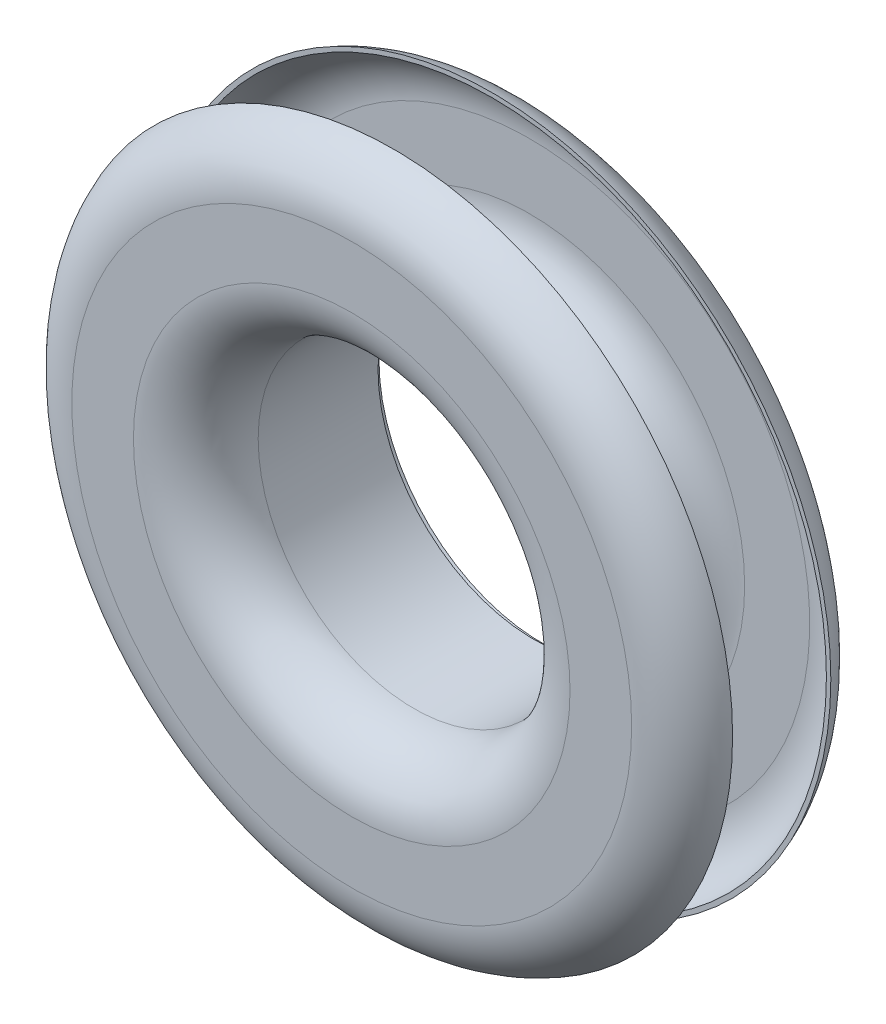
from build123d import *

# Parameters (mm, degrees)
SKETCH3_R           = 10.3505
SKETCH3_R_2         = 4.7625
BOSS_EXTRUDE1_DEPTH = 1.2827
BOSS_EXTRUDE2_START = -5.461
SKETCH4_R           = 5.0165
SKETCH4_R_2         = 4.7625
BOSS_EXTRUDE2_DEPTH = 5.461
FILLET1_R           = 1.905
SKETCH5_R           = 10.3505
SKETCH5_R_2         = 4.7625
BOSS_EXTRUDE3_DEPTH = 1.2827
FILLET2_R           = 1.905
SHELL1_T            = -0.127


# Read off the part's stored shape, not the designer's step: Shell2
with BuildPart() as part:
    # Sketch3 → Boss-Extrude1 (new body)
    with BuildSketch(Plane.XY.offset(5.461)):
        Circle(SKETCH3_R)
        Circle(SKETCH3_R_2, mode=Mode.SUBTRACT)
    extrude(amount=BOSS_EXTRUDE1_DEPTH)

    # Sketch4 → Boss-Extrude2 (add)
    with BuildSketch(Plane.XY.offset(5.461).offset(BOSS_EXTRUDE2_START)):
        Circle(SKETCH4_R)
        Circle(SKETCH4_R_2, mode=Mode.SUBTRACT)
    extrude(amount=BOSS_EXTRUDE2_DEPTH)

    # Fillet1
    # the kernel refuses this fillet: 1.905 mm, written as the material it takes off along each edge
    with BuildSketch(Plane(origin=(0, 0, 6.7437), x_dir=(1, 0, 0), z_dir=(0, -1, 0))) as fillet1_piece_1:
        with BuildLine():
            CenterArc((8.550009036, -1.905), FILLET1_R, 19.066580101, 70.933419899)
            Line((8.550009036, 0), (8.550009036, 0.0381))
            Line((8.550009036, 0.0381), (10.3505, 0.0381))
            Line((10.3505, 0.0381), (10.3886, 0))
            ThreePointArc((10.3886, 0), (10.3886, -0.64135), (10.386509819, -1.270254))
            Line((10.386509819, -1.270254), (10.3505, -1.2827))
        make_face()
    revolve(axis=Axis((0, 0, 6.7437), (0, 0, 1)), mode=Mode.SUBTRACT)
    with BuildSketch(Plane(origin=(0, 0, 6.7437), x_dir=(1, 0, 0), z_dir=(0, -1, 0))) as fillet1_piece_2:
        with BuildLine():
            CenterArc((4.7625 + FILLET1_R, -FILLET1_R), FILLET1_R, 90, 90)
            Line((4.7625, -FILLET1_R), (4.7625 - FILLET1_R * 0.02, -FILLET1_R))
            Line((4.7625 - FILLET1_R * 0.02, -FILLET1_R), (4.7625 - FILLET1_R * 0.02, FILLET1_R * 0.02))
            Line((4.7625 - FILLET1_R * 0.02, FILLET1_R * 0.02), (4.7625 + FILLET1_R, FILLET1_R * 0.02))
            Line((4.7625 + FILLET1_R, FILLET1_R * 0.02), (4.7625 + FILLET1_R, 0))
        make_face()
    revolve(axis=Axis((0, 0, 6.7437), (0, 0, 1)), mode=Mode.SUBTRACT)

    # Shell2 outline → Shell2 (revolve, cut)
    with BuildSketch(Plane.XZ):
        with BuildLine():
            ThreePointArc((6.6675, 6.6167), (5.653884047, 6.299476061), (5.001959034, 5.461))
            Line((5.001959034, 5.461), (10.215550003, 5.461))
            ThreePointArc((10.215550003, 5.461), (9.563624989, 6.299476061), (8.550009036, 6.6167))
            Line((8.550009036, 6.6167), (6.6675, 6.6167))
        make_face()
    revolve(axis=Axis((0, 0, 0), (0, 0, 1)), mode=Mode.SUBTRACT)

    # SurfaceCut1
    split(bisect_by=Plane(origin=(0, 0, 1.178299904), x_dir=(-1, 0, 0), z_dir=(0, 0, -1)), keep=Keep.BOTTOM)



with BuildPart() as body_2:
    # Sketch5 → Boss-Extrude3 (new body)
    with BuildSketch(Plane.XY.offset(2.460999904)):
        Circle(SKETCH5_R)
        Circle(SKETCH5_R_2, mode=Mode.SUBTRACT)
    extrude(amount=-BOSS_EXTRUDE3_DEPTH)

    # Fillet2
    # the kernel refuses this fillet: 1.905 mm, written as the material it takes off along each edge
    with BuildSketch(Plane(origin=(0, 0, 1.178299904), x_dir=(1, 0, 0), z_dir=(0, -1, 0))) as fillet2_piece_1:
        with BuildLine():
            CenterArc((8.550009036, 1.905), FILLET2_R, 270, 70.933419899)
            Line((8.550009036, 0), (8.550009036, -0.0381))
            Line((8.550009036, -0.0381), (10.3505, -0.0381))
            Line((10.3505, -0.0381), (10.3886, 0))
            ThreePointArc((10.3886, 0), (10.3886, 0.64135), (10.386509819, 1.270254))
            Line((10.386509819, 1.270254), (10.3505, 1.2827))
        make_face()
    revolve(axis=Axis((0, 0, 1.178299904), (0, 0, 1)), mode=Mode.SUBTRACT)
    with BuildSketch(Plane(origin=(0, 0, 1.178299904), x_dir=(1, 0, 0), z_dir=(0, -1, 0))) as fillet2_piece_2:
        with BuildLine():
            CenterArc((6.562990964, 1.905), FILLET2_R, 199.066580101, 70.933419899)
            Line((6.562990964, 0), (6.562990964, -0.0381))
            Line((6.562990964, -0.0381), (4.7625, -0.0381))
            Line((4.7625, -0.0381), (4.7244, 0))
            ThreePointArc((4.7244, 0), (4.7244, 0.64135), (4.726490181, 1.270254))
            Line((4.726490181, 1.270254), (4.7625, 1.2827))
        make_face()
    revolve(axis=Axis((0, 0, 1.178299904), (0, 0, 1)), mode=Mode.SUBTRACT)

    # Shell1
    shell1_openings = [body_2.faces().sort_by_distance(p)[0] for p in [
        (-10.05774365, 0, 2.460999904),
    ]]
    offset(amount=SHELL1_T, openings=shell1_openings, kind=Kind.INTERSECTION)


with BuildPart() as part_1:
    add(part.part)

    add(body_2.part)  # Revolve4 merges body 2
    # Sketch11 → Revolve4 (revolve)
    with BuildSketch(Plane(origin=(0, 0, 0), x_dir=(1, 0, 0), z_dir=(0, 1, 0))):
        with BuildLine():
            Line((5.0165, -1.178299904), (4.980029457, -0.930931764))
            ThreePointArc((4.980029457, -0.930931764), (6.604, -0.826699904), (8.227970543, -0.930931764))
            ThreePointArc((8.227970543, -0.930931764), (8.266070543, -1.062921584), (8.1915, -1.178299904))
            ThreePointArc((8.1915, -1.178299904), (6.604, -1.076699904), (5.0165, -1.178299904))
        make_face()
    revolve(axis=Axis((0, 0, 1.178299904), (0, 0, -1)))


solid = part_1.part
